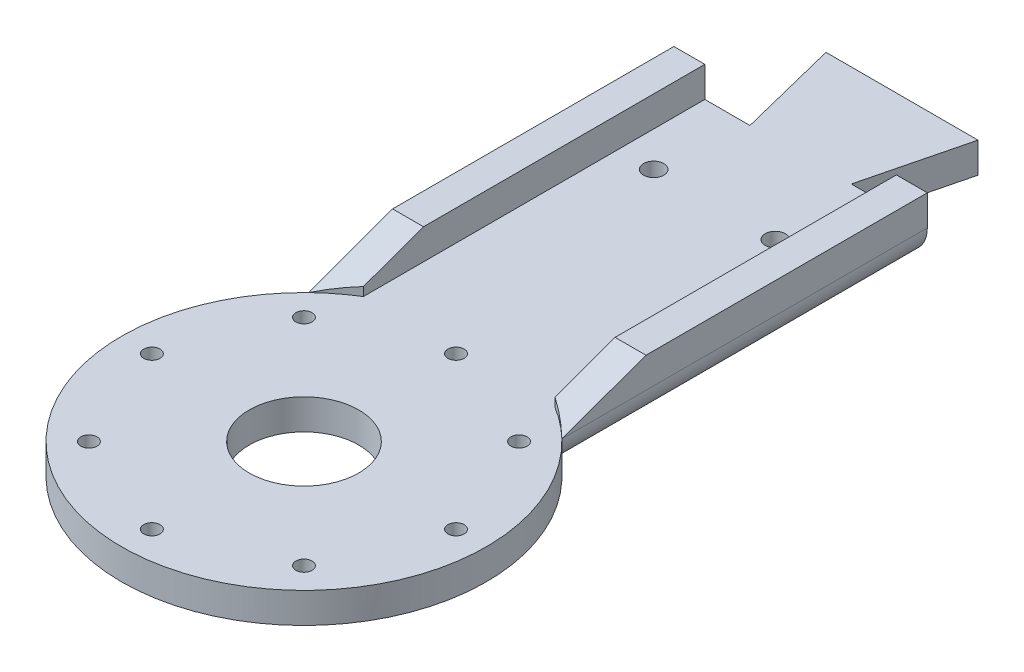
from build123d import *

# Parameters (mm, degrees)
CROQUIS1_R              = 5.400000088
CROQUIS1_R_2            = 0.999999877
CROQUIS1_R_3            = 1.000000024
CROQUIS1_R_4            = 0.800000203
SALIENTE_EXTRUIR1_DEPTH = 3
SALIENTE_EXTRUIR2_DEPTH = 3
CORTAR_EXTRUIR1_DEPTH   = 42
REDONDEO1_R             = 3


with BuildPart() as part:
    # Croquis1 → Saliente-Extruir1 (new body)
    with BuildSketch(Plane(origin=(0, 0, 0), x_dir=(1, 0, 0), z_dir=(0, 1, 0))):
        with BuildLine():
            Line((-12.273088561, 28.840073314), (-4.773088561, 28.840073314))
            Line((-4.773088561, 28.840073314), (-7.273088561, 38.840073314))
            Line((-7.273088561, 38.840073314), (7.726911439, 38.840073314))
            Line((7.726911439, 38.840073314), (5.226911439, 28.840073314))
            Line((5.226911439, 28.840073314), (12.726911439, 28.840073314))
            Line((12.726911439, 28.840073314), (12.726911439, -7.216334642))
            ThreePointArc((12.726911439, -7.216334642), (0.226911439, -38.159647961), (-12.273088561, -7.216334642))
            Line((-12.273088561, -7.216334642), (-12.273088561, 28.840073314))
        make_face()
        with Locations(Location((0.226911124, -20.159617436, 0), (0, 0, 270))):
            Circle(CROQUIS1_R, mode=Mode.SUBTRACT)
        with Locations(Location((6.226911439, 20.340382277, 0), (0, 0, 270))):
            Circle(CROQUIS1_R_2, mode=Mode.SUBTRACT)
        with Locations(Location((-5.77308837, 20.34038236, 0), (0, 0, 270))):
            Circle(CROQUIS1_R_3, mode=Mode.SUBTRACT)
        with Locations(Location((0.226911439, -5.159617656, 0), (0, 0, 270))):
            Circle(CROQUIS1_R_4, mode=Mode.SUBTRACT)
        with Locations(Location((10.836055587, -9.554069047, 0), (0, 0, 270))):
            Circle(CROQUIS1_R_4, mode=Mode.SUBTRACT)
        with Locations(Location((15.230506978, -20.163213195, 0), (0, 0, 270))):
            Circle(CROQUIS1_R_4, mode=Mode.SUBTRACT)
        with Locations(Location((10.836055587, -30.772357343, 0), (0, 0, 270))):
            Circle(CROQUIS1_R_4, mode=Mode.SUBTRACT)
        with Locations(Location((0.226911439, -35.166808735, 0), (0, 0, 270))):
            Circle(CROQUIS1_R_4, mode=Mode.SUBTRACT)
        with Locations(Location((-10.382232709, -30.772357343, 0), (0, 0, 270))):
            Circle(CROQUIS1_R_4, mode=Mode.SUBTRACT)
        with Locations(Location((-14.776684101, -20.163213195, 0), (0, 0, 270))):
            Circle(CROQUIS1_R_4, mode=Mode.SUBTRACT)
        with Locations(Location((-10.382232709, -9.554069047, 0), (0, 0, 270))):
            Circle(CROQUIS1_R_4, mode=Mode.SUBTRACT)
    extrude(amount=SALIENTE_EXTRUIR1_DEPTH)

    # Croquis2 → Saliente-Extruir2 (add)
    with BuildSketch(Plane(origin=(0, 3, 0), x_dir=(1, 0, 0), z_dir=(0, 1, 0))):
        with BuildLine():
            Line((-12.273088561, 28.840073314), (-9.223088561, 28.840073314))
            Line((-9.223088561, 28.840073314), (-9.223088561, -4.847006046))
            ThreePointArc((-9.223088561, -4.847006046), (-10.811840961, -5.949602868), (-12.273088561, -7.216334642))
            Line((-12.273088561, -7.216334642), (-12.273088561, 28.840073314))
        make_face()
        with BuildLine():
            Line((9.676910809, 28.840073314), (9.676910809, -4.847006046))
            ThreePointArc((9.676910809, -4.847006046), (11.265663208, -5.949602868), (12.726910809, -7.216334642))
            Line((12.726910809, -7.216334642), (12.726910809, 28.840073314))
            Line((12.726910809, 28.840073314), (9.676910809, 28.840073314))
        make_face()
    extrude(amount=SALIENTE_EXTRUIR2_DEPTH)

    # Croquis3 → Cortar-Extruir1 (cut)
    with BuildSketch(Plane.ZY.offset(12.273088561)):
        Polygon((-1.083665358, 6), (7.216334642, 3), (7.216334642, 6), align=None)
    extrude(amount=-CORTAR_EXTRUIR1_DEPTH, mode=Mode.SUBTRACT)

    # Redondeo1
    redondeo1_edges = [part.edges().sort_by_distance(p)[0] for p in [
        (12.726911439, 0, -10.811869336),
        (-12.273088561, 0, -10.811869336),
    ]]
    fillet(redondeo1_edges, radius=REDONDEO1_R - 0.0001)  # a hair under: the kernel refuses the full size


solid = part.part
